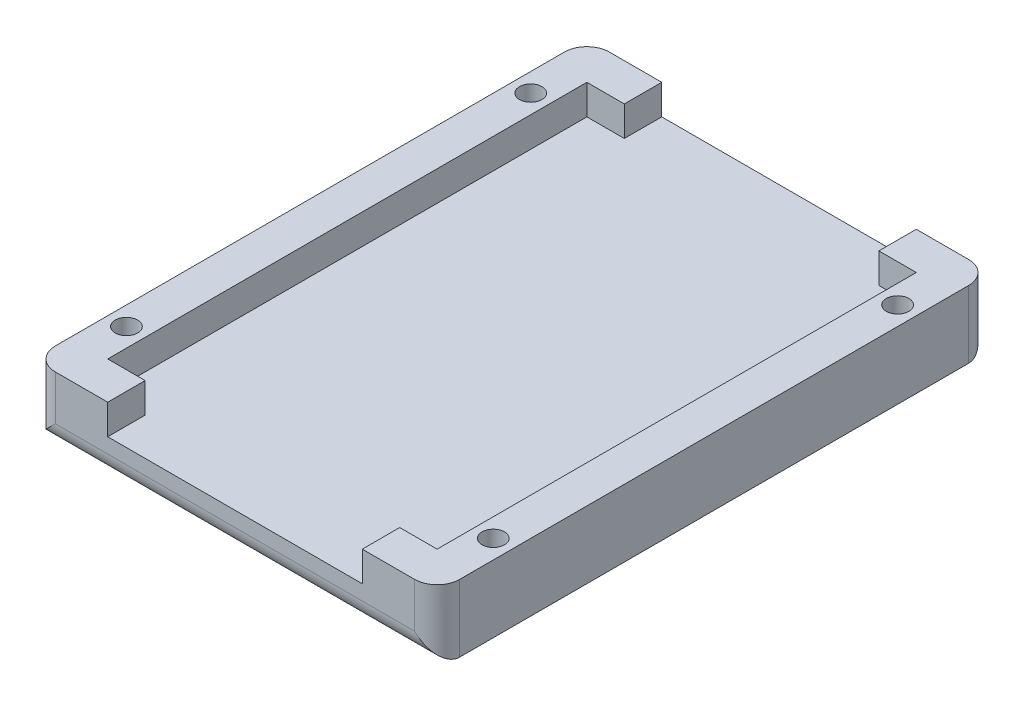
from build123d import *

# Parameters (mm, degrees)
ESBO_O1_W                = 54
ESBO_O1_H                = 74
RESSALTO_EXTRUS_O1_DEPTH = 5
ESBO_O2_W                = 54
ESBO_O2_H                = 74
ESBO_O2_W_2              = 44
ESBO_O2_H_2              = 64
RESSALTO_EXTRUS_O2_DEPTH = 4
ESBO_O3_W                = 34
ESBO_O3_H                = 4
CORTE_EXTRUS_O1_DEPTH    = 135.5
ESBO_O5_R                = 1.5
CORTE_EXTRUS_O2_DEPTH    = 135.5
ESBO_O6_R                = 1.5
CORTE_EXTRUS_O3_DEPTH    = 135.5
FILETE4_R                = 3


with BuildPart() as part:
    # Esboço1 → Ressalto-extrusão1 (new body)
    with BuildSketch(Plane(origin=(0, 0, 0), x_dir=(1, 0, 0), z_dir=(0, 1, 0))):
        Rectangle(ESBO_O1_W, ESBO_O1_H)
    extrude(amount=RESSALTO_EXTRUS_O1_DEPTH)

    # Esboço2 → Ressalto-extrusão2 (add)
    with BuildSketch(Plane(origin=(0, 5, 0), x_dir=(1, 0, 0), z_dir=(0, 1, 0))):
        Rectangle(ESBO_O2_W, ESBO_O2_H)
        Rectangle(ESBO_O2_W_2, ESBO_O2_H_2, mode=Mode.SUBTRACT)
    extrude(amount=RESSALTO_EXTRUS_O2_DEPTH)

    # Esboço3 → Corte-extrusão1 (cut)
    with BuildSketch(Plane.XY.offset(37)):
        with Locations((0, 7)):
            Rectangle(ESBO_O3_W, ESBO_O3_H)
    extrude(amount=-CORTE_EXTRUS_O1_DEPTH, mode=Mode.SUBTRACT)

    # Esboço5 → Corte-extrusão2 (cut)
    with BuildSketch(Plane(origin=(0, 9, 0), x_dir=(1, 0, 0), z_dir=(0, 1, 0))):
        with Locations((24.5, -27)):
            Circle(ESBO_O5_R)
        with Locations((24.5, 27)):
            Circle(ESBO_O5_R)
    extrude(amount=-CORTE_EXTRUS_O2_DEPTH, mode=Mode.SUBTRACT)

    # Esboço6 → Corte-extrusão3 (cut)
    with BuildSketch(Plane(origin=(0, 9, 0), x_dir=(1, 0, 0), z_dir=(0, 1, 0))):
        with Locations((-24.5, -27)):
            Circle(ESBO_O6_R)
        with Locations((-24.5, 27)):
            Circle(ESBO_O6_R)
    extrude(amount=-CORTE_EXTRUS_O3_DEPTH, mode=Mode.SUBTRACT)

    # Filete4
    filete4_edges = [part.edges().sort_by_distance(p)[0] for p in [
        (27, 4.5, 37),
        (27, 4.5, -37),
        (-27, 4.5, -37),
        (-27, 4.5, 37),
        (0, 0, 37),
        (0, 0, -37),
    ]]
    fillet(filete4_edges, radius=FILETE4_R)


solid = part.part
